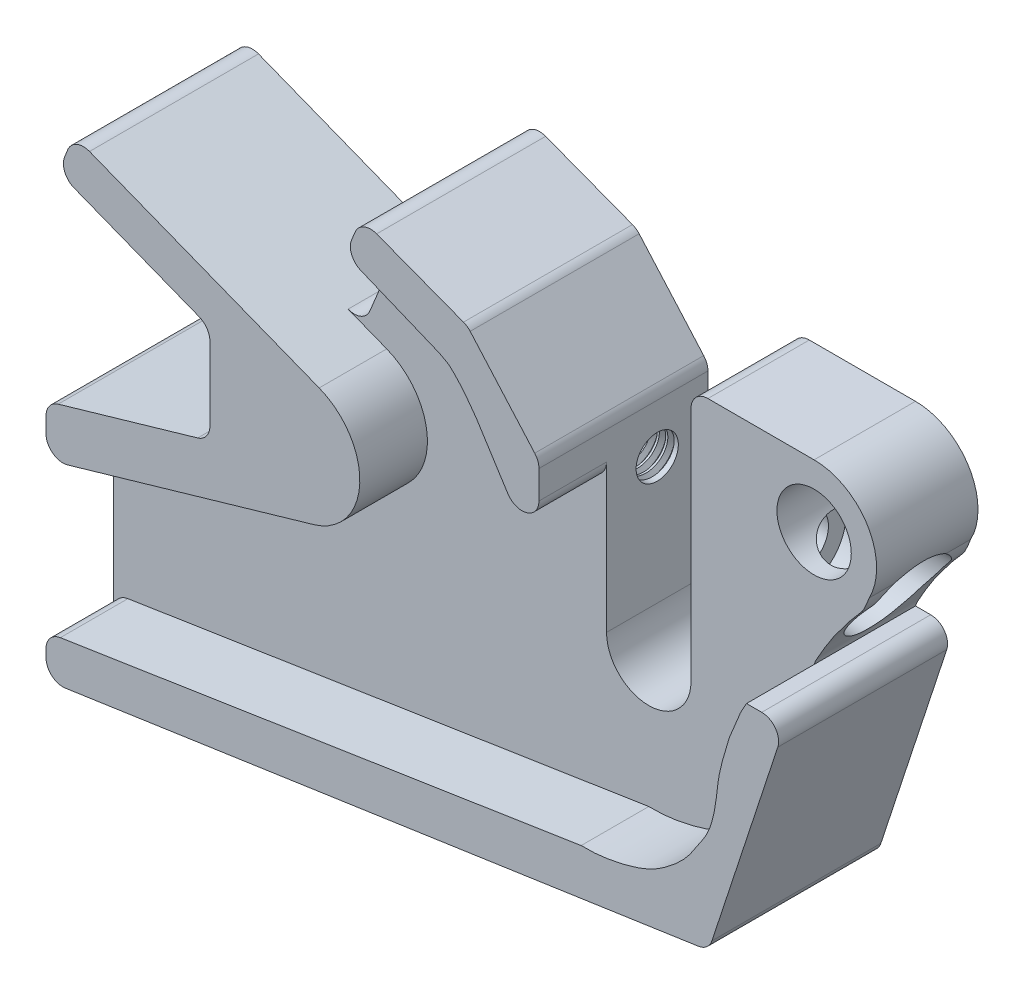
from build123d import *

# Parameters (mm, degrees)
BOSS_EXTRUDE1_OUTLINE_R         = 4.4
BOSS_EXTRUDE1_DEPTH             = 12
SKETCH1_3_R                     = 7.578000113984699
BOSS_EXTRUDE2_DEPTH             = 20
FILLET1_R                       = 2
SKETCH4_R                       = 3.049999999999999
CUT_EXTRUDE2_DEPTH              = 30
CUT_EXTRUDE1_OUTLINE_W          = 2.0500000000000003
CUT_EXTRUDE1_OUTLINE_H          = 14.322746089000006
TAP_DRILL_FOR_M6X1_0_TAP1_D     = 5
TAP_DRILL_FOR_M6X1_0_TAP1_DEPTH = 40
TAP_DRILL_FOR_M6X1_0_TAP1_TIP   = 1.5021515475689007
THREAD1_PITCH                   = 1


# Read off the part's stored shape, not the designer's step: Boss-Extrude1, Cut-Extrude1
with BuildPart() as part:
    # Boss-Extrude1 outline → Boss-Extrude1 (new body)
    with BuildSketch(Plane.XY):
        with BuildLine():
            Line((103.388377927, 40.31628874), (103.535345735, 40.584708371))
            add(Edge.make_bspline(
                [(103.535345735, 40.584708371), (103.581204194271, 40.7315605776292), (103.641432086827, 40.8981411417218), (103.799978338402, 41.2288042662943), (104.025040058231, 41.5620371407204), (104.286687082608, 42.0456895388673), (104.612180008153, 42.6618602385337), (105.050879090503, 43.3289300463845), (105.537510856573, 44.1631018896441), (106.118914085331, 44.9679588923197), (106.747196305975, 45.8247523475688), (107.330772063737, 46.575740678553), (107.858367864103, 47.2972333552226), (108.382584535735, 47.8633325820183), (108.85364050244, 48.4513527565526), (109.300441517283, 48.9177693608685), (109.664227011097, 49.6954112329888), (109.920140566685, 50.2521719719002), (110.053458639, 50.659790327)],
                knots=[0, 0, 0, 0, 0.0359962609771171, 0.0453072430231923, 0.0931098204607526, 0.134015167544367, 0.182580339347103, 0.266125203246051, 0.332446127481693, 0.422594103427706, 0.512770434414783, 0.596696234441131, 0.659110299116454, 0.734875714214065, 0.788154166491233, 0.846795928379473, 0.893864773145245, 1, 1, 1, 1], degree=3))
            ThreePointArc((110.053458639, 50.659790327), (109.886942961, 57.960246844), (103.535345735, 61.563246359))
            Line((103.535345735, 61.563246359), (88.968274755, 61.563246359))
            Line((88.968274755, 61.563246359), (88.968274755, 31.593555634))
            ThreePointArc((88.968274755, 31.593555634), (83.968274755, 26.593555634), (78.968274755, 31.593555634))
            Line((78.968274755, 31.593555634), (78.968274755, 42.187825254))
            Line((78.968274755, 42.187825254), (71.540745427, 53.865587102))
            add(Edge.make_bspline(
                [(67.166812946, 58.333047532), (67.5306657893749, 58.1481584549403), (68.2162670427706, 57.8297177535993), (69.7375428076036, 56.3375911346666), (70.7671129056723, 54.9980358685141), (71.540745427, 53.865587102)],
                knots=[0, 0, 0, 0, 0.194176371742941, 0.35338295041403, 1, 1, 1, 1], degree=3))
            Line((67.166812946, 58.333047532), (56.038116318, 62.903316899))
            Line((56.038116318, 62.903316899), (50.212333598, 48.717420333))
            Line((50.212333598, 48.717420333), (52.954646155, 47.643031131))
            ThreePointArc((52.954646155, 47.643031131), (57.7604479, 40.242238256), (52.301438942, 33.309223992))
            Line((52.301438942, 33.309223992), (20.622854325, 24.120186594))
            Line((20.622854325, 24.120186594), (20.622828377, 6.463885488))
            Line((20.622828377, 6.463885488), (83.968274755, 16.245051977))
            add(Edge.make_bspline(
                [(83.968274755, 16.245051977), (85.723526082872, 16.1880419195703), (88.0554514722074, 16.5327763401812), (90.8046128743577, 17.332066529357), (92.5418077050436, 18.0402738117156), (94.2663519876761, 19.2079659833443), (95.8587355256365, 20.5518463839223), (96.9523680129147, 21.873318506761), (97.6462741791133, 23.0395105236749), (98.3627632640891, 24.0121243118778), (99.0097628897008, 25.1250885271442), (99.5845217727538, 26.7462710430433), (99.9434616129301, 28.7044451912498), (100.141549957194, 30.8497195812236), (100.520186360318, 32.862078885211), (101.10989408311, 34.6453105558399), (101.507193736161, 36.2278883270294), (102.065926657264, 37.4006487385135), (102.486282255798, 38.4065888453723), (102.848420446074, 39.4293905758429), (103.210900740248, 39.9903976145284), (103.388377927, 40.31628874)],
                knots=[0, 0, 0, 0, 0.152789617644616, 0.203407430478959, 0.2495415477182, 0.315642101263545, 0.383953809437737, 0.430642319801909, 0.464331002732189, 0.502103997650032, 0.53590036569843, 0.576119062163794, 0.651343022494558, 0.708753060139745, 0.763978239382022, 0.829308208851071, 0.872446503047582, 0.905722515991334, 0.942221454554583, 0.967584869185462, 1, 1, 1, 1], degree=3))
        make_face()
        with Locations((103.535345735, 54.163246359)):
            Circle(BOSS_EXTRUDE1_OUTLINE_R, mode=Mode.SUBTRACT)
    extrude(amount=BOSS_EXTRUDE1_DEPTH)

    # Sketch1<3> → Boss-Extrude2 (add)
    with BuildSketch(Plane.XY):
        with BuildLine():
            Line((52.95464713088683, 47.643030748312306), (50.21233359803197, 48.7174203330503))
            Line((50.21233359803197, 48.7174203330503), (23.91329061275728, 59.02091682731907))
            Line((23.91329061275728, 59.02091682731907), (22.08936487086497, 54.365458215317176))
            Line((22.08936487086497, 54.365458215317176), (40.01978708427513, 47.34063824296787))
            Line((40.01978708427513, 47.34063824296787), (44.49575262392416, 45.58703468895018))
            ThreePointArc((44.49575262392417, 45.58703468895018), (48.4005247200828, 47.95082949329833), (52.95464713088681, 47.64303074831224))
        make_face()
        with Locations((50.19030425910602, 40.58721795212874)):
            Circle(SKETCH1_3_R)
        with BuildLine():
            ThreePointArc((43.63005434703988, 36.79390715299979), (42.648765078906784, 41.32969523869845), (44.49575262392417, 45.58703468895018))
            Line((44.49575262392416, 45.58703468895018), (40.01978708427513, 47.34063824296787))
            Line((40.01978708427513, 47.34063824296787), (40.019787084275116, 35.746673468318164))
            Line((40.01978708427511, 35.74667346831816), (43.63005434703988, 36.79390715299979))
        make_face()
        with BuildLine():
            Line((20.622854324708115, 24.120186594388674), (52.30143900683574, 33.30922401118043))
            ThreePointArc((52.30143900683574, 33.30922401118043), (47.364634323302816, 33.55574050130448), (43.63005434703988, 36.79390715299979))
            Line((43.63005434703988, 36.79390715299979), (40.01978708427511, 35.74667346831816))
            Line((40.01978708427511, 35.74667346831816), (20.622854324708136, 30.12018659438867))
            Line((20.622854324708136, 30.12018659438867), (20.622854324708115, 24.120186594388674))
        make_face()
        with BuildLine():
            Line((108.09825459829777, 40.58470837115217), (103.53534573522575, 40.58470837115218))
            Line((103.5353457354515, 40.58470837115218), (103.38837792674808, 40.31628873971178))
            add(Edge.make_bspline(
                [(83.96827475522947, 16.24505197698971), (85.72352608287204, 16.188041919570285), (88.05545147220737, 16.53277634018118), (90.80461287435767, 17.33206652935703), (92.54180770504358, 18.040273811715558), (94.26635198767613, 19.207965983344344), (95.85873552563653, 20.551846383922324), (96.95236801291468, 21.873318506760988), (97.64627417911335, 23.039510523674917), (98.3627632640891, 24.012124311877827), (99.00976288970077, 25.12508852714421), (99.58452177275385, 26.74627104304325), (99.94346161293005, 28.704445191249825), (100.14154995719386, 30.849719581223617), (100.52018636031825, 32.862078885210956), (101.10989408311028, 34.645310555839885), (101.5071937361607, 36.22788832702944), (102.06592665726437, 37.400648738513546), (102.48628225579844, 38.40658884537233), (102.84842044607363, 39.4293905758429), (103.21090074024752, 39.990397614528426), (103.38837792674808, 40.31628873971178)],
                knots=[0, 0, 0, 0, 0.15278961764461613, 0.20340743047895937, 0.24954154771819959, 0.31564210126354453, 0.383953809437737, 0.4306423198019086, 0.4643310027321893, 0.5021039976500323, 0.5359003656984298, 0.5761190621637939, 0.6513430224945583, 0.7087530601397454, 0.7639782393820217, 0.8293082088510708, 0.8724465030475821, 0.9057225159913337, 0.9422214545545828, 0.9675848691854619, 1, 1, 1, 1], degree=3))
            Line((83.96827475522947, 16.24505197698971), (20.622828377499033, 6.463885488208273))
            Line((20.62282837749903, 6.463885488069424), (20.62282110130341, 1.512651604953091))
            Line((20.6228211013034, 1.512651604953092), (99.05570161577305, 13.035195870356917))
            Line((99.05570161577305, 13.035195870356915), (108.09825459829777, 40.58470837115217))
        make_face()
        with BuildLine():
            Line((78.96827475522947, 42.187825253742076), (78.96827475522947, 43.59355563425329))
            Line((78.96827475522947, 43.59355563425329), (78.96827475522947, 49.285790380927594))
            Line((78.96827475522947, 49.285790380927594), (78.96827475522947, 52.81430633566804))
            Line((78.96827475522947, 52.81430633566804), (78.96827475522947, 53.14598079095306))
            Line((78.96827475522947, 53.14598079095306), (77.37761026058446, 54.95096484877639))
            Line((77.37761026058446, 54.95096484877639), (70.50082285395956, 62.75430218344684))
            Line((70.50082285395956, 62.75430218344684), (68.3903409242587, 57.62049653795413))
            add(Edge.make_bspline(
                [(68.39034092425892, 57.620496537954104), (68.60270993607135, 57.45022207716797), (69.77589066925941, 56.287697416771124), (70.76711290567229, 54.9980358685141), (71.54074542683735, 53.865587102003296)],
                knots=[0.22419046507503362, 0.22419046507503362, 0.22419046507503362, 0.22419046507503362, 0.35338295041403034, 1, 1, 1, 1], degree=3))
            Line((71.54074542683735, 53.865587102003296), (77.94135898527813, 43.80236991179886))
            Line((77.94135898527813, 43.80236991179886), (78.96827475522947, 42.187825253742076))
        make_face()
        with BuildLine():
            add(Edge.make_bspline(
                [(67.16681294608784, 58.3330475317527), (67.53066578937492, 58.148158454940294), (67.96561960838267, 57.94613577996739), (68.34100319904482, 57.6600548260751), (68.39034092425892, 57.620496537954104)],
                knots=[0, 0, 0, 0, 0.19417637174294056, 0.22419046507503362, 0.22419046507503362, 0.22419046507503362, 0.22419046507503362], degree=3))
            Line((68.3903409242587, 57.62049653795413), (70.50082285395956, 62.75430218344684))
            Line((70.50082285395956, 62.75430218344684), (57.93755222306168, 67.52848103011922))
            Line((57.93755222306168, 67.52848103011922), (56.03811631838445, 62.90331689854259))
            Line((56.03811631838445, 62.90331689854259), (67.16681294608784, 58.3330475317527))
        make_face()
    extrude(amount=BOSS_EXTRUDE2_DEPTH)

    # Fillet1
    fillet1_edges = [part.edges().sort_by_distance(p)[0] for p in [
        (78.96827475522947, 53.14598079095306, 10),
        (70.50082285395956, 62.75430218344684, 10),
        (99.05570161577305, 13.035195870356915, 10),
        (108.09825459829777, 40.58470837115217, 10),
        (88.968274755, 61.563246359, 6),
        (57.93755222306168, 67.52848103011922, 10),
        (56.03811631838445, 62.90331689854259, 16),
        (78.96827475522947, 42.187825253742076, 16),
        (20.622854324708115, 24.120186594388674, 16),
        (20.622854324708136, 30.12018659438867, 10),
        (23.91329061275728, 59.02091682731907, 10),
        (22.08936487086497, 54.365458215317176, 10),
        (40.01978708427513, 47.34063824296787, 10),
        (40.01978708427511, 35.746673468318164, 10),
        (20.622821101303405, 1.5126516049530916, 10),
        (20.622828377499033, 6.463885488138849, 16),
        (50.212333598, 48.717420333, 6),
    ]]
    fillet(fillet1_edges, radius=FILLET1_R)

    # Sketch4 → Cut-Extrude2 (cut)
    with BuildSketch(Plane.ZY.offset(-88.96827475522946)):
        with Locations((6, 46.593555634253306)):
            Circle(SKETCH4_R)
    extrude(amount=-CUT_EXTRUDE2_DEPTH, mode=Mode.SUBTRACT)

    # Cut-Extrude1 outline → Cut-Extrude1 (revolve, cut)
    with BuildSketch(Plane(origin=(0, 46.593555634, 6), x_dir=(0, 1, 0), z_dir=(0, 0, -1))):
        with Locations((4.074999999999999, 103.34975785950002)):
            Rectangle(CUT_EXTRUDE1_OUTLINE_W, CUT_EXTRUDE1_OUTLINE_H)
    revolve(axis=Axis((0, 46.593555634, 6), (1, 0, 0)), mode=Mode.SUBTRACT)

    # Tap Drill for M6x1.0 Tap1
    with Locations(Plane(origin=(96.188384815, 46.593555634, 6), x_dir=(0, 0, 1), z_dir=(1, 0, 0))):
        with Locations((0, 0)):
            Hole(TAP_DRILL_FOR_M6X1_0_TAP1_D / 2, depth=TAP_DRILL_FOR_M6X1_0_TAP1_DEPTH)
            with Locations((0, 0, -(TAP_DRILL_FOR_M6X1_0_TAP1_DEPTH + TAP_DRILL_FOR_M6X1_0_TAP1_TIP / 2))):  # 118° drill point
                Cone(0, TAP_DRILL_FOR_M6X1_0_TAP1_D / 2, TAP_DRILL_FOR_M6X1_0_TAP1_TIP, mode=Mode.SUBTRACT)

    # Thread1: the profile of Thread Profile1 profile screwed along a right-hand helix of 23 turns, 8 arcs to a turn; built about Z, then put on its axis
    thread1_z = Axis((0, 0, 0), (0, 0, 1))
    thread1_corners = [(2.4997, 0, -0.000173205), (3.041265875, 0, 0.312499998), (3.041265875, 0, 0.437499998), (2.4997, 0, 0.750173202)]
    with BuildLine(mode=Mode.PRIVATE) as thread1_profile:
        Line(thread1_corners[0], thread1_corners[1])
        Line(thread1_corners[1], thread1_corners[2])
        Line(thread1_corners[2], thread1_corners[3])
        Line(thread1_corners[3], thread1_corners[0])
    thread1_cap = Face(thread1_profile.wire())
    thread1_turn_angles = [0, 22.5, 45, 67.5, 90, 112.5, 135, 157.5, 180, 202.5, 225, 247.5, 270, 292.5, 315, 337.5, 360]
    thread1_turn_weights = [1, 0.9238795325112867, 1, 0.9238795325112867, 1, 0.9238795325112867, 1, 0.9238795325112867, 1, 0.9238795325112867, 1, 0.9238795325112867, 1, 0.9238795325112867, 1, 0.9238795325112867, 1]
    thread1_turn_rails = [Edge.make_bspline([Vector(p[0], p[1], 0).rotate(thread1_z, thread1_turn_angles[k]) / thread1_turn_weights[k] + Vector(0, 0, p[2] + THREAD1_PITCH * thread1_turn_angles[k] / 360) for k in range(17)], [0, 0, 0, 1, 1, 2, 2, 3, 3, 4, 4, 5, 5, 6, 6, 7, 7, 8, 8, 8], 2, thread1_turn_weights) for p in thread1_corners]
    thread1_turn_sides = [Face.make_surface_from_curves(thread1_turn_rails[p[0]], thread1_turn_rails[p[1]]) for p in [(0, 1), (1, 2), (2, 3), (3, 0)]]
    thread1 = Plane(origin=(78.968274755, 46.593555634, 6), x_dir=(0, 0, 1), z_dir=(-1, 0, 0)) * Solid(Shell([*[p.moved(Location((0, 0, THREAD1_PITCH * i))) for i in range(23) for p in thread1_turn_sides], thread1_cap, thread1_cap.rotate(thread1_z, 8280).moved(Location((0, 0, THREAD1_PITCH * 8280 / 360)))]))
    add(thread1, mode=Mode.SUBTRACT)


solid = part.part
